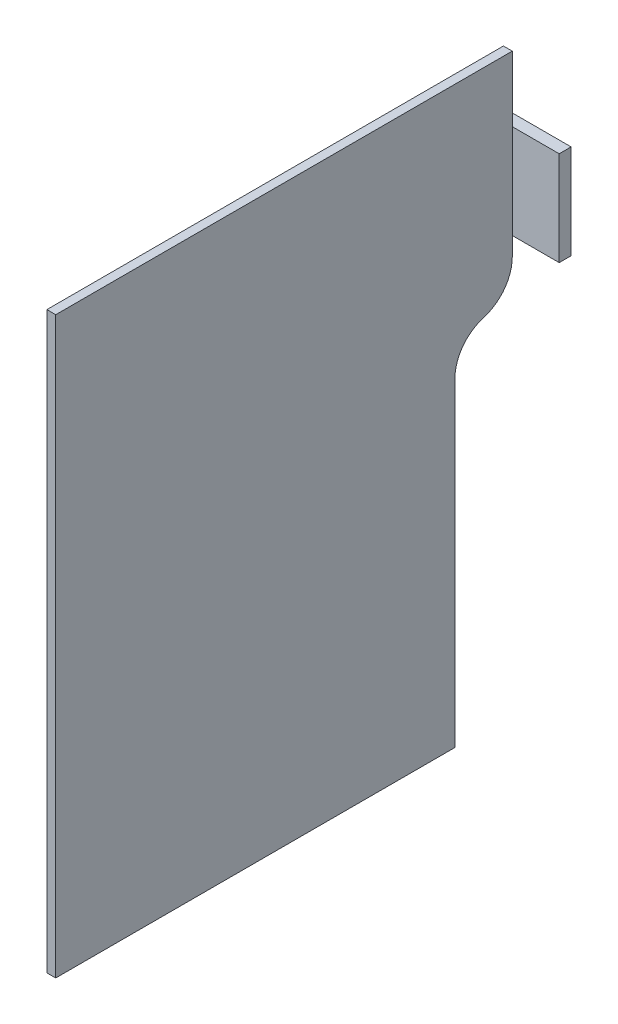
from build123d import *

# Parameters (mm, degrees)
SKETCH_1_W          = 23.757047591
SKETCH_1_H          = 23.75704759
EXTRUDE_1_DEPTH     = 3
SKETCH_2_W          = 2.229782935
SKETCH_2_H          = 144.701322111
EXTRUDE_2_DEPTH     = 115
FILLET_1_R          = 20
SKETCH_3_W          = 17.433740909
SKETCH_3_H          = 91.487428691
CUT_EXTRUDE_1_DEPTH = 75
FILLET_2_R          = 10
FILLET_3_R          = 10


with BuildPart() as part:
    # 草图1 → 凸台-拉伸1 (new body)
    with BuildSketch(Plane.XY):
        with Locations((-21.874536556, 0.392800792)):
            Rectangle(SKETCH_1_W, SKETCH_1_H)
    extrude(amount=EXTRUDE_1_DEPTH)

    # 草图2 → 凸台-拉伸2 (add)
    with BuildSketch(Plane.XY.offset(3)):
        with Locations((-22.937382742, -43.600525925)):
            Rectangle(SKETCH_2_W, SKETCH_2_H)
    extrude(amount=EXTRUDE_2_DEPTH)

    # 圆角1
    # the kernel refuses this fillet: 20 mm, written as the material it adds along each edge
    with BuildSketch(Plane(origin=(-24.052274209, -11.485723003, 3), x_dir=(-1, 0, 0), z_dir=(0, 1, 0))) as fillet_1_piece_1:
        with BuildLine():
            CenterArc((20, 17.144275835), FILLET_1_R, 180, 59.005172318)
            Line((0, 17.144275835), (0, 0))
            Line((0, 0), (9.700786142, 0))
        make_face()
    extrude(amount=23.75704759)

    # 草图3 → 切除-拉伸1 (cut)
    with BuildSketch(Plane(origin=(-21.822491274, 0, 0), x_dir=(0, 0, -1), z_dir=(1, 0, 0))):
        with Locations((-8.716870455, -71.123991133)):
            Rectangle(SKETCH_3_W, SKETCH_3_H)
    extrude(amount=-CUT_EXTRUDE_1_DEPTH, mode=Mode.SUBTRACT)

    # 圆角2
    fillet_2_edges = [part.edges().sort_by_distance(p)[0] for p in [
        (-22.937382741, -25.380276788, 17.433740909),
    ]]
    fillet(fillet_2_edges, radius=FILLET_2_R)

    # 圆角3
    fillet_3_edges = [part.edges().sort_by_distance(p)[0] for p in [
        (-22.937382741, -25.380276788, 3),
    ]]
    fillet(fillet_3_edges, radius=FILLET_3_R)


solid = part.part
